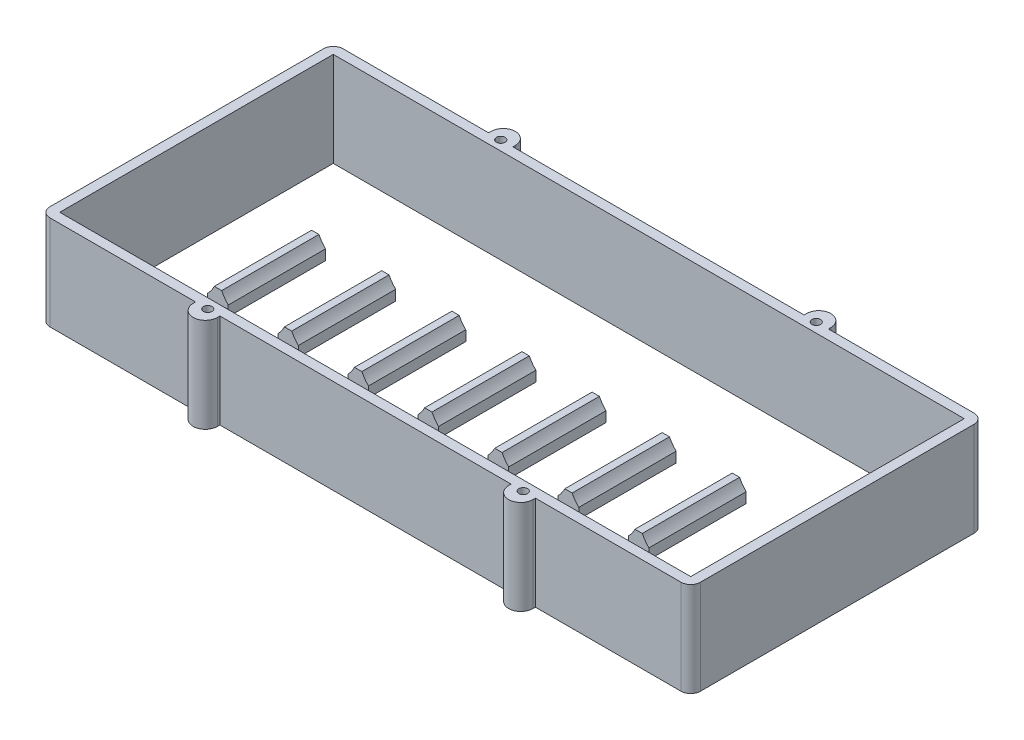
from build123d import *

# Parameters (mm, degrees)
BOSS_EXTRUDE1_OUTLINE_W        = 169.78
BOSS_EXTRUDE1_OUTLINE_H        = 76.48
BOSS_EXTRUDE1_OUTLINE_W_2      = 164.7
BOSS_EXTRUDE1_OUTLINE_H_2      = 71.4
BOSS_EXTRUDE1_DEPTH            = 24.65
BOSS_EXTRUDE2_DEPTH            = 12.7
LPATTERN2_COUNT                = 8
LPATTERN2_PITCH                = 18.3
SKETCH6_W                      = 6.35
SKETCH6_H                      = 3.81
BOSS_EXTRUDE3_DEPTH            = 24.65
MIRROR2_COPY_1_SKETCH_W        = 6.35
MIRROR2_COPY_1_SKETCH_H        = 3.81
MIRROR2_COPY_1_DEPTH           = 24.65
F_4_40_TAPPED_HOLE1_AT_2_COUNT = 2
F_4_40_TAPPED_HOLE1_AT_2_PITCH = 82.35
F_4_40_TAPPED_HOLE1_AT_3_COUNT = 2
F_4_40_TAPPED_HOLE1_AT_3_PITCH = 112.386444467
F_4_40_TAPPED_HOLE1_AT_4_COUNT = 2
F_4_40_TAPPED_HOLE1_AT_4_PITCH = 76.48
FILLET1_RADIUS                 = 3.175
FILLET1_LENGTH                 = 24.65
FILLET2_RADIUS                 = 3.175
FILLET2_LENGTH                 = 24.65
FILLET3_RADIUS                 = 3.175
FILLET3_LENGTH                 = 24.65
FILLET4_RADIUS                 = 3.175
FILLET4_LENGTH                 = 24.65
FILLET5_R                      = 2.54


# Read off the part's stored shape, not the designer's step: Boss-Extrude1
with BuildPart() as part:
    # Boss-Extrude1 outline → Boss-Extrude1 (new body)
    with BuildSketch(Plane(origin=(0, 0, 0), x_dir=(1, 0, 0), z_dir=(0, 1, 0))):
        Rectangle(BOSS_EXTRUDE1_OUTLINE_W, BOSS_EXTRUDE1_OUTLINE_H)
        Rectangle(BOSS_EXTRUDE1_OUTLINE_W_2, BOSS_EXTRUDE1_OUTLINE_H_2, mode=Mode.SUBTRACT)
    extrude(amount=BOSS_EXTRUDE1_DEPTH)

    # Sketch6 → Boss-Extrude3 (add)
    with BuildSketch(Plane(origin=(0, 24.65, 0), x_dir=(1, 0, 0), z_dir=(0, 1, 0))):
        with Locations((-41.175, 40.145)):
            Rectangle(SKETCH6_W, SKETCH6_H)
    boss_extrude3 = extrude(amount=-BOSS_EXTRUDE3_DEPTH)

    # Mirror1: Boss-Extrude3 across plane
    add(boss_extrude3.mirror(Plane(origin=(0, 0, 0), x_dir=(0, 0, 1), z_dir=(1, 0, 0))))

    # Mirror2: Boss-Extrude3 across plane
    add(boss_extrude3.mirror(Plane.XY))

    # Mirror2 copy 1 sketch → Mirror2 copy 1 (add)
    with BuildSketch(Plane(origin=(0, 24.65, 0), x_dir=(-1, 0, 0), z_dir=(0, 1, 0))):
        with Locations((-41.175, 40.145)):
            Rectangle(MIRROR2_COPY_1_SKETCH_W, MIRROR2_COPY_1_SKETCH_H)
    extrude(amount=-MIRROR2_COPY_1_DEPTH)

    # Sketch7 → #4-40 Tapped Hole1 (revolve, cut)
    with BuildSketch(Plane(origin=(-41.175, 24.65, -38.24), x_dir=(0, 0, 1), z_dir=(1, 0, 0))):
        Polygon((0, 0), (0, 8.299152758), (1.1303, 7.62), (1.1303, 0), align=None)
    f_4_40_tapped_hole1 = revolve(axis=Axis((-41.175, 31, -38.24), (0, -1, 0)), mode=Mode.SUBTRACT)

    # #4-40 Tapped Hole1 at 2: #4-40 Tapped Hole1 ×2
    with Locations(*[(i * F_4_40_TAPPED_HOLE1_AT_2_PITCH, 0, 0) for i in range(1, F_4_40_TAPPED_HOLE1_AT_2_COUNT)]):
        add(f_4_40_tapped_hole1, mode=Mode.SUBTRACT)

    # #4-40 Tapped Hole1 at 3: #4-40 Tapped Hole1 ×2
    with Locations(*[Vector(0.732739614553475, 0, 0.6805091162240408) * (i * F_4_40_TAPPED_HOLE1_AT_3_PITCH) for i in range(1, F_4_40_TAPPED_HOLE1_AT_3_COUNT)]):
        add(f_4_40_tapped_hole1, mode=Mode.SUBTRACT)

    # #4-40 Tapped Hole1 at 4: #4-40 Tapped Hole1 ×2
    with Locations(*[(0, 0, i * F_4_40_TAPPED_HOLE1_AT_4_PITCH) for i in range(1, F_4_40_TAPPED_HOLE1_AT_4_COUNT)]):
        add(f_4_40_tapped_hole1, mode=Mode.SUBTRACT)

    # Fillet1: full round fillet: the end face becomes a half cylinder, R = half its width
    fillet1_face = Plane((-41.175, 12.325, -42.05), x_dir=(0, -1, 0), z_dir=(0, 0, -1))  # on the end face: x along it, z out of the body
    fillet1_slab = fillet1_face.offset(-FILLET1_RADIUS / 2) * Box(FILLET1_LENGTH, 2 * FILLET1_RADIUS, FILLET1_RADIUS, mode=Mode.PRIVATE)  # the body's end, R deep
    fillet1_round = Plane((-41.175, 12.325, -38.875), x_dir=(0, 0, -1), z_dir=(0, -1, 0)) * Cylinder(FILLET1_RADIUS, FILLET1_LENGTH, mode=Mode.PRIVATE)  # its axis R under the face
    add(fillet1_slab - fillet1_round, mode=Mode.SUBTRACT)

    # Fillet2: full round fillet: the end face becomes a half cylinder, R = half its width
    fillet2_face = Plane((41.175, 12.325, -42.05), x_dir=(0, -1, 0), z_dir=(0, 0, -1))  # on the end face: x along it, z out of the body
    fillet2_slab = fillet2_face.offset(-FILLET2_RADIUS / 2) * Box(FILLET2_LENGTH, 2 * FILLET2_RADIUS, FILLET2_RADIUS, mode=Mode.PRIVATE)  # the body's end, R deep
    fillet2_round = Plane((41.175, 12.325, -38.875), x_dir=(0, 0, -1), z_dir=(0, -1, 0)) * Cylinder(FILLET2_RADIUS, FILLET2_LENGTH, mode=Mode.PRIVATE)  # its axis R under the face
    add(fillet2_slab - fillet2_round, mode=Mode.SUBTRACT)

    # Fillet3: full round fillet: the end face becomes a half cylinder, R = half its width
    fillet3_face = Plane((41.175, 12.325, 42.05), x_dir=(0, -1, 0), z_dir=(0, 0, 1))  # on the end face: x along it, z out of the body
    fillet3_slab = fillet3_face.offset(-FILLET3_RADIUS / 2) * Box(FILLET3_LENGTH, 2 * FILLET3_RADIUS, FILLET3_RADIUS, mode=Mode.PRIVATE)  # the body's end, R deep
    fillet3_round = Plane((41.175, 12.325, 38.875), x_dir=(0, 0, 1), z_dir=(0, -1, 0)) * Cylinder(FILLET3_RADIUS, FILLET3_LENGTH, mode=Mode.PRIVATE)  # its axis R under the face
    add(fillet3_slab - fillet3_round, mode=Mode.SUBTRACT)

    # Fillet4: full round fillet: the end face becomes a half cylinder, R = half its width
    fillet4_face = Plane((-41.175, 12.325, 42.05), x_dir=(0, -1, 0), z_dir=(0, 0, 1))  # on the end face: x along it, z out of the body
    fillet4_slab = fillet4_face.offset(-FILLET4_RADIUS / 2) * Box(FILLET4_LENGTH, 2 * FILLET4_RADIUS, FILLET4_RADIUS, mode=Mode.PRIVATE)  # the body's end, R deep
    fillet4_round = Plane((-41.175, 12.325, 38.875), x_dir=(0, 0, 1), z_dir=(0, -1, 0)) * Cylinder(FILLET4_RADIUS, FILLET4_LENGTH, mode=Mode.PRIVATE)  # its axis R under the face
    add(fillet4_slab - fillet4_round, mode=Mode.SUBTRACT)

    # Fillet5
    fillet5_edges = [part.edges().sort_by_distance(p)[0] for p in [
        (84.89, 12.325, 38.24),
        (84.89, 12.325, -38.24),
        (-84.89, 12.325, -38.24),
        (-84.89, 12.325, 38.24),
    ]]
    fillet(fillet5_edges, radius=FILLET5_R)


with BuildPart() as body_2:
    # Sketch4 → Boss-Extrude2 (new, symmetric)
    with BuildSketch(Plane.XY):
        with BuildLine():
            Line((-66.729972952, 0), (-61.370027048, 0))
            Line((-61.370027048, 0), (-61.370027048, 2.679972952))
            ThreePointArc((-61.370027048, 2.679972952), (-62.330046898, 3.809877988), (-63.09497407, 5.08))
            Line((-63.09497407, 5.08), (-65.00502593, 5.08))
            ThreePointArc((-65.00502593, 5.08), (-65.769953102, 3.809877988), (-66.729972952, 2.679972952))
            Line((-66.729972952, 2.679972952), (-66.729972952, 0))
        make_face()
    extrude(amount=BOSS_EXTRUDE2_DEPTH, both=True)


with BuildPart() as lpattern2_1:
    # LPattern2: pattern copy
    add(body_2.part.moved(Location(Vector(1, 0, 0) * (1 * LPATTERN2_PITCH))))


with BuildPart() as lpattern2_2:
    # LPattern2: pattern copy
    add(body_2.part.moved(Location(Vector(1, 0, 0) * (2 * LPATTERN2_PITCH))))


with BuildPart() as lpattern2_3:
    # LPattern2: pattern copy
    add(body_2.part.moved(Location(Vector(1, 0, 0) * (3 * LPATTERN2_PITCH))))


with BuildPart() as lpattern2_4:
    # LPattern2: pattern copy
    add(body_2.part.moved(Location(Vector(1, 0, 0) * (4 * LPATTERN2_PITCH))))


with BuildPart() as lpattern2_5:
    # LPattern2: pattern copy
    add(body_2.part.moved(Location(Vector(1, 0, 0) * (5 * LPATTERN2_PITCH))))


with BuildPart() as lpattern2_6:
    # LPattern2: pattern copy
    add(body_2.part.moved(Location(Vector(1, 0, 0) * (6 * LPATTERN2_PITCH))))


with BuildPart() as lpattern2_7:
    # LPattern2: pattern copy
    add(body_2.part.moved(Location(Vector(1, 0, 0) * (7 * LPATTERN2_PITCH))))


solid = Compound([part.part, body_2.part, lpattern2_1.part, lpattern2_2.part, lpattern2_3.part, lpattern2_4.part, lpattern2_5.part, lpattern2_6.part, lpattern2_7.part])
